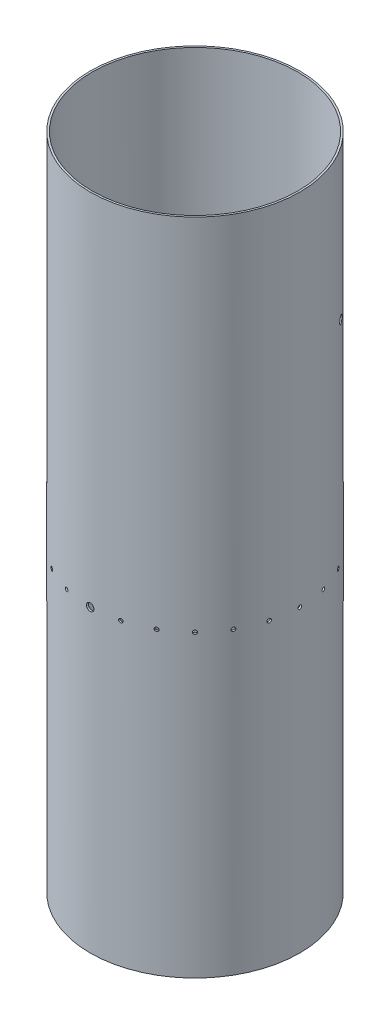
from build123d import *

# Parameters (mm, degrees)
SKETCH1_R               = 88.9
SKETCH1_R_2             = 87.3125
BOSS_EXTRUDE1_DEPTH     = 558.8
SKETCH10_R              = 1.5875
CUT_EXTRUDE1_DEPTH      = 3.81
CIRPATTERN1_COUNT       = 24
CUT_EXTRUDE2_DEPTH      = 594.104957126
CUT_EXTRUDE2_DEPTH_BACK = 594.104957126
SKETCH12_R              = 3.175
CUT_EXTRUDE4_DEPTH      = 573.768592145
CUT_EXTRUDE4_DEPTH_BACK = 573.768592145
SKETCH15_R              = 3.175


with BuildPart() as part:
    # Sketch1 → Boss-Extrude1 (new body)
    with BuildSketch(Plane(origin=(0, 0, 0), x_dir=(1, 0, 0), z_dir=(0, 1, 0))):
        Circle(SKETCH1_R)
        Circle(SKETCH1_R_2, mode=Mode.SUBTRACT)
    extrude(amount=BOSS_EXTRUDE1_DEPTH)

    # Sketch10 → Cut-Extrude1 (cut)
    with BuildSketch(Plane.XY.offset(88.9)):
        with Locations((0, 254)):
            Circle(SKETCH10_R)
    cut_extrude1 = extrude(amount=-CUT_EXTRUDE1_DEPTH, mode=Mode.SUBTRACT)

    # CirPattern1: Cut-Extrude1 ×24 about axis
    cirpattern1_axis = Axis((0, 558.8, 0), (0, -1, 0))
    for i in range(1, CIRPATTERN1_COUNT):
        add(cut_extrude1.rotate(cirpattern1_axis, i * 360 / CIRPATTERN1_COUNT), mode=Mode.SUBTRACT)

    # Sketch12 → Cut-Extrude2 (cut, two sides: drawn at the far end of the back side and taken through both)
    with BuildSketch(Plane.XY.offset(88.9).offset(-CUT_EXTRUDE2_DEPTH_BACK)):
        with Locations((0, 254)):
            Circle(SKETCH12_R)
    extrude(amount=CUT_EXTRUDE2_DEPTH + CUT_EXTRUDE2_DEPTH_BACK, mode=Mode.SUBTRACT)

    # Sketch15 → Cut-Extrude4 (cut, two sides: drawn at the far end of the back side and taken through both)
    with BuildSketch(Plane(origin=(0, 0, 0), x_dir=(0, 0, -1), z_dir=(1, 0, 0)).offset(-CUT_EXTRUDE4_DEPTH_BACK)):
        with Locations((50.8, 431.8)):
            Circle(SKETCH15_R)
    extrude(amount=CUT_EXTRUDE4_DEPTH + CUT_EXTRUDE4_DEPTH_BACK, mode=Mode.SUBTRACT)


solid = part.part
